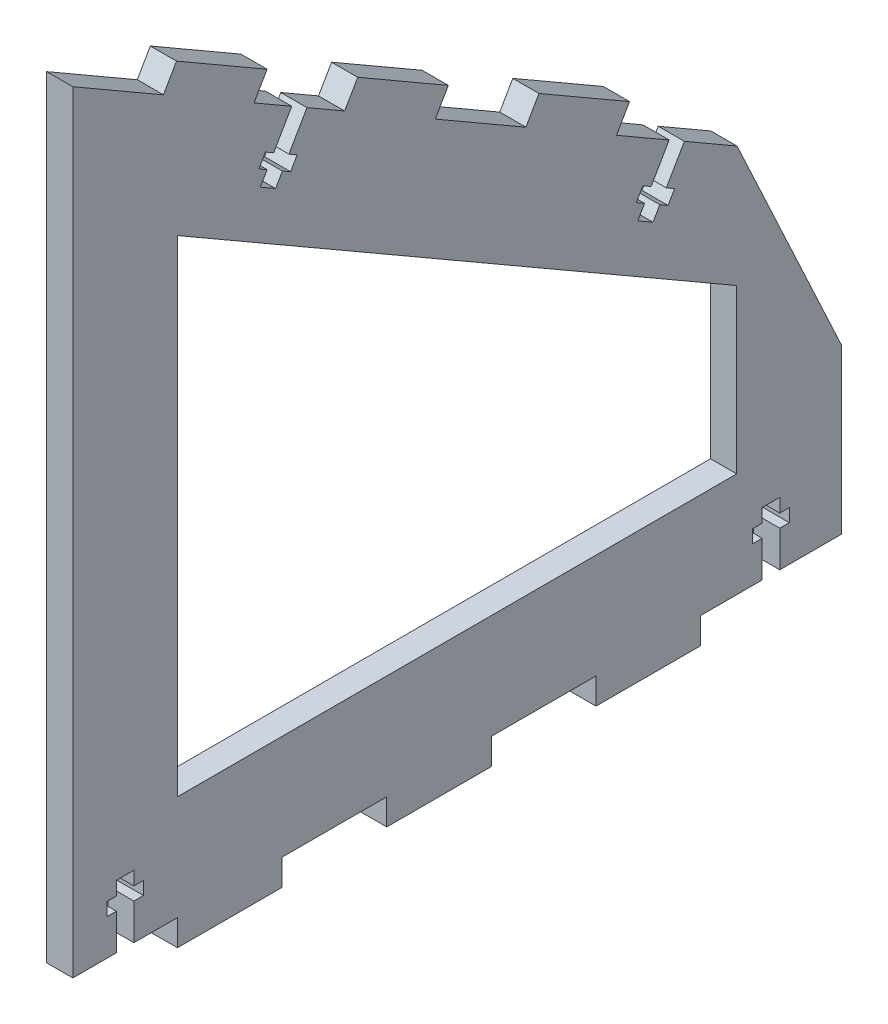
from build123d import *

# Parameters (mm, degrees)
BOSS_EXTRUDE1_DEPTH     = 3.175
CUT_EXTRUDE1_DEPTH      = 6.35
SKETCH4_W               = 6.35
SKETCH4_H               = 25.4
BOSS_EXTRUDE3_DEPTH     = 6.35
LPATTERN2_COUNT         = 3
LPATTERN2_PITCH         = 50.8
CUT_EXTRUDE2_DEPTH      = 6.35
SKETCH7_W               = 6.35
SKETCH7_H               = 25.4
BOSS_EXTRUDE4_DEPTH     = 6.35
LPATTERN3_COUNT         = 3
LPATTERN3_PITCH         = 50.8
CUT_EXTRUDE3_DEPTH      = 356.712029055
CUT_EXTRUDE3_DEPTH_BACK = 356.712029055


with BuildPart() as part:
    # Sketch1 → Boss-Extrude1 (new, symmetric)
    with BuildSketch(Plane.ZY.offset(32.038437852)):
        Polygon((-215.9, 95.25), (-215.9, 174.9125), (-29.333338138, 282.626812448), (-29.333338138, 95.25), align=None)
    extrude(amount=BOSS_EXTRUDE1_DEPTH, both=True)

    # Sketch2 → Cut-Extrude1 (cut)
    with BuildSketch(Plane.ZY.offset(35.213437852)):
        Polygon((-190.5, 160.247803163), (-190.5, 120.65), (-54.733338138, 120.65), (-54.733338138, 238.632721936), align=None)
    extrude(amount=-CUT_EXTRUDE1_DEPTH, mode=Mode.SUBTRACT)

    # Sketch4 → Boss-Extrude3 (add)
    with BuildSketch(Plane.XZ.offset(-95.25)):
        with Locations((-32.038437852, -67.433338138)):
            Rectangle(SKETCH4_W, SKETCH4_H)
    boss_extrude3 = extrude(amount=BOSS_EXTRUDE3_DEPTH)

    # LPattern2: Boss-Extrude3 ×3
    with Locations(*[(0, 0, -i * LPATTERN2_PITCH) for i in range(1, LPATTERN2_COUNT)]):
        add(boss_extrude3)

    # Sketch5 → Cut-Extrude2 (cut)
    with BuildSketch(Plane(origin=(-28.863437852, 0, 0), x_dir=(0, 0, -1), z_dir=(1, 0, 0))):
        Polygon((196.683069069, 95.25), (200.950269069, 95.25), (200.950269069, 104.013), (203.261669069, 104.013), (203.261669069, 107.188), (200.950269069, 107.188), (200.950269069, 110.49), (196.683069069, 110.49), (196.683069069, 107.188), (194.371669069, 107.188), (194.371669069, 104.013), (196.683069069, 104.013), align=None)
        Polygon((39.899738138, 95.25), (44.166938138, 95.25), (44.166938138, 104.013), (46.478338138, 104.013), (46.478338138, 107.188), (44.166938138, 107.188), (44.166938138, 110.49), (39.899738138, 110.49), (39.899738138, 107.188), (37.588338138, 107.188), (37.588338138, 104.013), (39.899738138, 104.013), align=None)
    extrude(amount=-CUT_EXTRUDE2_DEPTH, mode=Mode.SUBTRACT)

    # Sketch7 → Boss-Extrude4 (add)
    with BuildSketch(Plane(origin=(0, 224.671817339, -129.71433422), x_dir=(1, 0, 0), z_dir=(0, 0.8660254037844386, -0.5000000000000001))):
        with Locations((-32.038437852, -77.809990219)):
            Rectangle(SKETCH7_W, SKETCH7_H)
    boss_extrude4 = extrude(amount=BOSS_EXTRUDE4_DEPTH)

    # LPattern3: Boss-Extrude4 ×3
    with Locations(*[Vector(0, -0.5000000000000002, -0.8660254037844386) * (i * LPATTERN3_PITCH) for i in range(1, LPATTERN3_COUNT)]):
        add(boss_extrude4)

    # Sketch8 → Cut-Extrude3 (cut, two sides: drawn at the far end of the back side and taken through both)
    with BuildSketch(Plane.ZY.offset(35.213437852).offset(-CUT_EXTRUDE3_DEPTH_BACK)):
        Polygon((-215.9, 135.08125), (-190.584946415, 189.528153002), (-215.9, 174.9125), align=None)
        Polygon((-82.478199476, 251.943612448), (-86.173703079, 249.810012448), (-81.792203079, 242.221031835), (-83.793934198, 241.065331835), (-82.206434198, 238.315701178), (-80.204703079, 239.471401178), (-78.553703079, 236.611785294), (-74.858199476, 238.745385294), (-76.509199476, 241.605001178), (-74.507468358, 242.760701178), (-76.094968358, 245.510331835), (-78.096699476, 244.354631835), align=None)
        Polygon((-174.102526243, 199.044282725), (-177.798029846, 196.910682725), (-173.416529846, 189.321702112), (-175.418260964, 188.166002112), (-173.830760964, 185.416371455), (-171.829029846, 186.572071455), (-170.178029846, 183.712455571), (-166.482526243, 185.846055571), (-168.133526243, 188.705671455), (-166.131795125, 189.861371455), (-167.719295125, 192.611002112), (-169.721026243, 191.455302112), align=None)
    extrude(amount=CUT_EXTRUDE3_DEPTH + CUT_EXTRUDE3_DEPTH_BACK, mode=Mode.SUBTRACT)


solid = part.part
